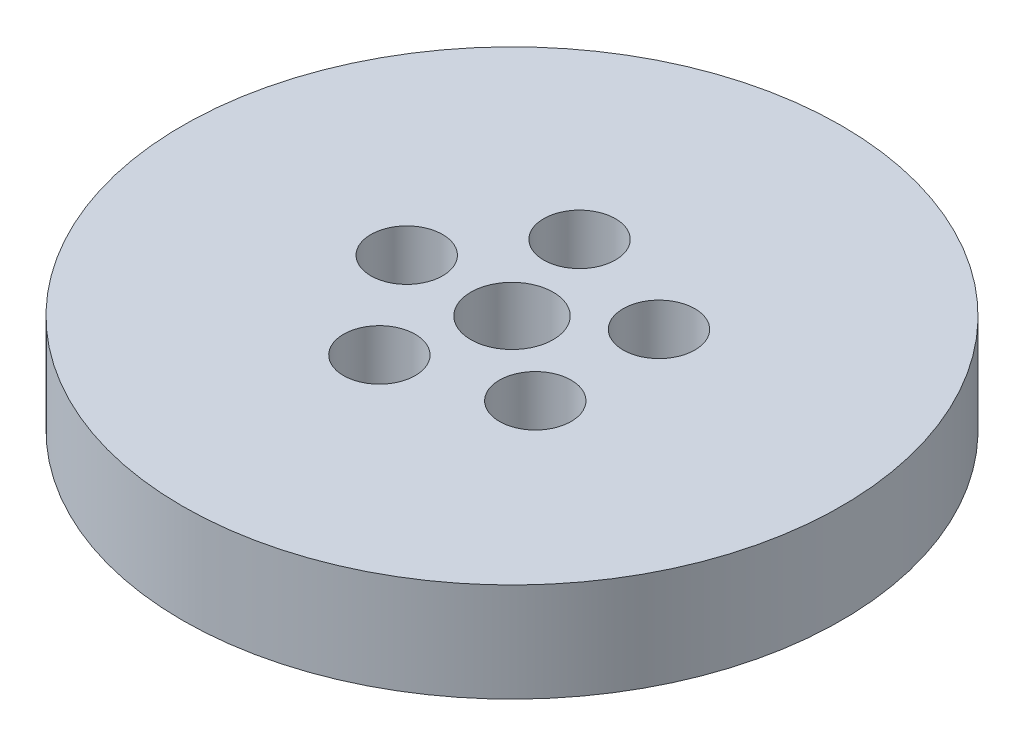
from build123d import *

# Parameters (mm, degrees)
SKETCH1_R           = 40
BOSS_EXTRUDE1_DEPTH = 12
SKETCH2_R           = 5
CUT_EXTRUDE1_DEPTH  = 58.827329179
SKETCH3_R           = 4.35295607
CUT_EXTRUDE2_DEPTH  = 9.709694408
CIRPATTERN1_COUNT   = 5


with BuildPart() as part:
    # Sketch1 → Boss-Extrude1 (new body)
    with BuildSketch(Plane(origin=(0, 0, 0), x_dir=(1, 0, 0), z_dir=(0, 1, 0))):
        Circle(SKETCH1_R)
    extrude(amount=BOSS_EXTRUDE1_DEPTH)

    # Sketch2 → Cut-Extrude1 (cut, through all)
    with BuildSketch(Plane(origin=(0, 0, 0), x_dir=(1, 0, 0), z_dir=(0, 1, 0))):
        Circle(SKETCH2_R)
    extrude(amount=CUT_EXTRUDE1_DEPTH, mode=Mode.SUBTRACT)

    # Sketch3 → Cut-Extrude2 (cut)
    with BuildSketch(Plane(origin=(0, 12, 0), x_dir=(1, 0, 0), z_dir=(0, 1, 0))):
        with Locations((-12.773893776, 0)):
            Circle(SKETCH3_R)
    cut_extrude2 = extrude(amount=-CUT_EXTRUDE2_DEPTH, mode=Mode.SUBTRACT)

    # CirPattern1: Cut-Extrude2 ×5 about axis
    cirpattern1_axis = Axis((0, 0, 0), (0, 1, 0))
    for i in range(1, CIRPATTERN1_COUNT):
        add(cut_extrude2.rotate(cirpattern1_axis, i * 360 / CIRPATTERN1_COUNT), mode=Mode.SUBTRACT)


solid = part.part
